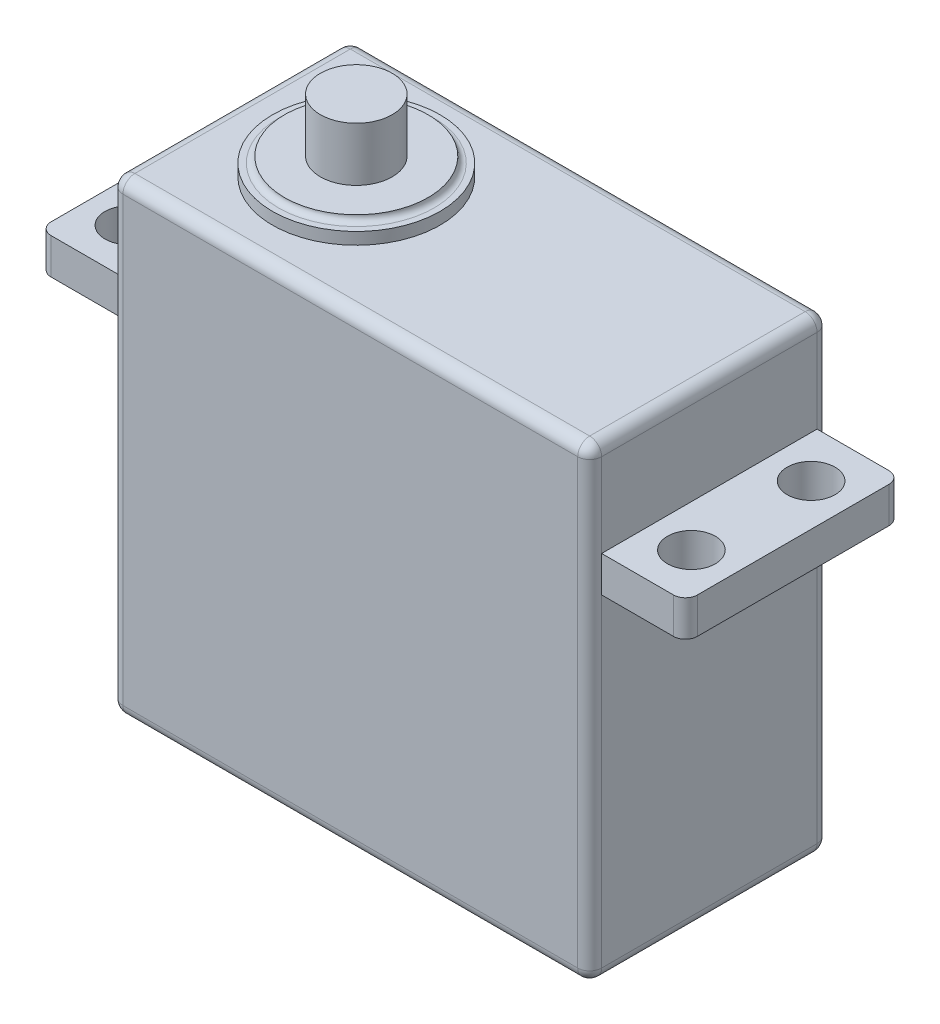
from build123d import *

# Parameters (mm, degrees)
SKETCH_1_W          = 40
SKETCH_1_H          = 39
EXTRUDE_1_DEPTH     = 20
FILLET_1_R          = 1
SKETCH_2_W          = 18
SKETCH_2_H          = 3
EXTRUDE_2_DEPTH     = 7
SKETCH_3_W          = 18
SKETCH_3_H          = 3
EXTRUDE_3_DEPTH     = 7
FILLET_8_R          = 1
FILLET_9_R          = 1
SKETCH_4_R          = 2
CUT_EXTRUDE_1_DEPTH = 7
SKETCH_5_R          = 2
CUT_EXTRUDE_2_DEPTH = 7
SKETCH_6_R          = 2
CUT_EXTRUDE_3_DEPTH = 7
SKETCH_8_R          = 2
CUT_EXTRUDE_4_DEPTH = 7
SKETCH_9_R          = 3
EXTRUDE_4_DEPTH     = 6
SKETCH_10_R         = 7
EXTRUDE_5_DEPTH     = 1
SKETCH_11_R         = 6
EXTRUDE_6_DEPTH     = 2
FILLET_11_R         = 0.5
SKETCH_12_W         = 12
SKETCH_12_H         = 0.5
CUT_EXTRUDE_6_DEPTH = 19
SKETCH_13_R         = 3
EXTRUDE_7_DEPTH     = 6


with BuildPart() as part:
    # 草图1 → 凸台-拉伸1 (new body)
    with BuildSketch(Plane.XY):
        with Locations((1.208791209, 10.42505216)):
            Rectangle(SKETCH_1_W, SKETCH_1_H)
    extrude(amount=EXTRUDE_1_DEPTH)

    # 圆角1
    fillet_1_edges = [part.edges().sort_by_distance(p)[0] for p in [
        (21.208791209, 10.42505216, 20),
        (1.208791209, 29.92505216, 20),
        (-18.791208791, 10.42505216, 20),
        (1.208791209, 29.92505216, 0),
        (21.208791209, 10.42505216, 0),
        (1.208791209, -9.07494784, 0),
        (-18.791208791, 10.42505216, 0),
        (-18.791208791, 29.92505216, 10),
        (21.208791209, 29.92505216, 10),
        (21.208791209, -9.07494784, 10),
        (-18.791208791, -9.07494784, 10),
        (1.208791209, -9.07494784, 20),
    ]]
    fillet(fillet_1_edges, radius=FILLET_1_R)

    # 草图2 → 凸台-拉伸2 (add)
    with BuildSketch(Plane.ZY.offset(18.791208791)):
        with Locations((10, 20.42505216)):
            Rectangle(SKETCH_2_W, SKETCH_2_H)
    extrude(amount=EXTRUDE_2_DEPTH)

    # 草图3 → 凸台-拉伸3 (add)
    with BuildSketch(Plane(origin=(21.208791209, 0, 0), x_dir=(0, 0, -1), z_dir=(1, 0, 0))):
        with Locations((-10, 20.42505216)):
            Rectangle(SKETCH_3_W, SKETCH_3_H)
    extrude(amount=EXTRUDE_3_DEPTH)

    # 圆角8
    fillet_8_edges = [part.edges().sort_by_distance(p)[0] for p in [
        (28.208791209, 20.42505216, 1),
    ]]
    fillet(fillet_8_edges, radius=FILLET_8_R)

    # 圆角9
    fillet_9_edges = [part.edges().sort_by_distance(p)[0] for p in [
        (-25.791208791, 20.42505216, 19),
        (-25.791208791, 20.42505216, 1),
        (28.208791209, 20.42505216, 19),
    ]]
    fillet(fillet_9_edges, radius=FILLET_9_R)

    # 草图4 → 切除-拉伸1 (cut)
    with BuildSketch(Plane(origin=(0, 21.92505216, 0), x_dir=(1, 0, 0), z_dir=(0, 1, 0))):
        with Locations(Location((-22.291208791, -5, 0), (0, 0, 180))):
            Circle(SKETCH_4_R)
    extrude(amount=-CUT_EXTRUDE_1_DEPTH, mode=Mode.SUBTRACT)

    # 草图5 → 切除-拉伸2 (cut)
    with BuildSketch(Plane(origin=(0, 21.92505216, 0), x_dir=(1, 0, 0), z_dir=(0, 1, 0))):
        with Locations(Location((-22.291208791, -15, 0), (0, 0, 180))):
            Circle(SKETCH_5_R)
    extrude(amount=-CUT_EXTRUDE_2_DEPTH, mode=Mode.SUBTRACT)

    # 草图6 → 切除-拉伸3 (cut)
    with BuildSketch(Plane(origin=(0, 21.92505216, 0), x_dir=(1, 0, 0), z_dir=(0, 1, 0))):
        with Locations(Location((24.708791209, -5, 0), (0, 0, 180))):
            Circle(SKETCH_6_R)
    extrude(amount=-CUT_EXTRUDE_3_DEPTH, mode=Mode.SUBTRACT)

    # 草图8 → 切除-拉伸4 (cut)
    with BuildSketch(Plane(origin=(0, 21.92505216, 0), x_dir=(1, 0, 0), z_dir=(0, 1, 0))):
        with Locations(Location((24.708791209, -15, 0), (0, 0, 180))):
            Circle(SKETCH_8_R)
    extrude(amount=-CUT_EXTRUDE_4_DEPTH, mode=Mode.SUBTRACT)

    # 草图9 → 凸台-拉伸4 (add)
    with BuildSketch(Plane(origin=(0, 29.92505216, 0), x_dir=(1, 0, 0), z_dir=(0, 1, 0))):
        with Locations(Location((-8.291208791, -10, 0), (0, 0, 90))):
            Circle(SKETCH_9_R)
    extrude(amount=EXTRUDE_4_DEPTH)

    # 草图10 → 凸台-拉伸5 (add)
    with BuildSketch(Plane(origin=(0, 29.92505216, 0), x_dir=(1, 0, 0), z_dir=(0, 1, 0))):
        with Locations(Location((-8.291208791, -10, 0), (0, 0, 90))):
            Circle(SKETCH_10_R)
    extrude(amount=EXTRUDE_5_DEPTH)

    # 草图11 → 凸台-拉伸6 (add)
    with BuildSketch(Plane(origin=(0, 29.92505216, 0), x_dir=(1, 0, 0), z_dir=(0, 1, 0))):
        with Locations(Location((-8.291208791, -10, 0), (0, 0, 270))):
            Circle(SKETCH_11_R)
    extrude(amount=EXTRUDE_6_DEPTH)

    # 圆角11
    fillet_11_edges = [part.edges().sort_by_distance(p)[0] for p in [
        (-8.291208791, 30.92505216, 4),
        (-8.291208791, 31.92505216, 4),
    ]]
    fillet(fillet_11_edges, radius=FILLET_11_R - 0.0001)  # a hair under: the kernel refuses the full size

    # 草图12 → 切除-拉伸6 (cut)
    with BuildSketch(Plane.XY.offset(20)):
        with Locations((-8.291208791, 31.67505216)):
            Rectangle(SKETCH_12_W, SKETCH_12_H)
    extrude(amount=-CUT_EXTRUDE_6_DEPTH, mode=Mode.SUBTRACT)


with BuildPart() as cut_extrude_6_piece_1:
    # of the separate pieces the step leaves, piece 1, a body of its own (cut_extrude_6_pieces)
    add(part.part.solids().sort_by_distance((-8.291208791, 30.92505216, 16.4999))[0])



with BuildPart() as cut_extrude_6_piece_2:
    # of the separate pieces the step leaves, piece 2, a body of its own (cut_extrude_6_pieces)
    add(part.part.solids().sort_by_distance((-8.291208791, 31.92505216, 7))[0])


with BuildPart() as cut_extrude_6_piece_1_1:
    add(cut_extrude_6_piece_1.part)

    add(cut_extrude_6_piece_2.part)  # 凸台-拉伸7 merges 切除-拉伸6 piece 2
    # 草图13 → 凸台-拉伸7 (add)
    with BuildSketch(Plane(origin=(0, 35.92505216, 0), x_dir=(1, 0, 0), z_dir=(0, 1, 0))):
        with Locations(Location((-8.291208791, -10, 0), (0, 0, 270))):
            Circle(SKETCH_13_R)
    extrude(amount=-EXTRUDE_7_DEPTH)


solid = cut_extrude_6_piece_1_1.part
